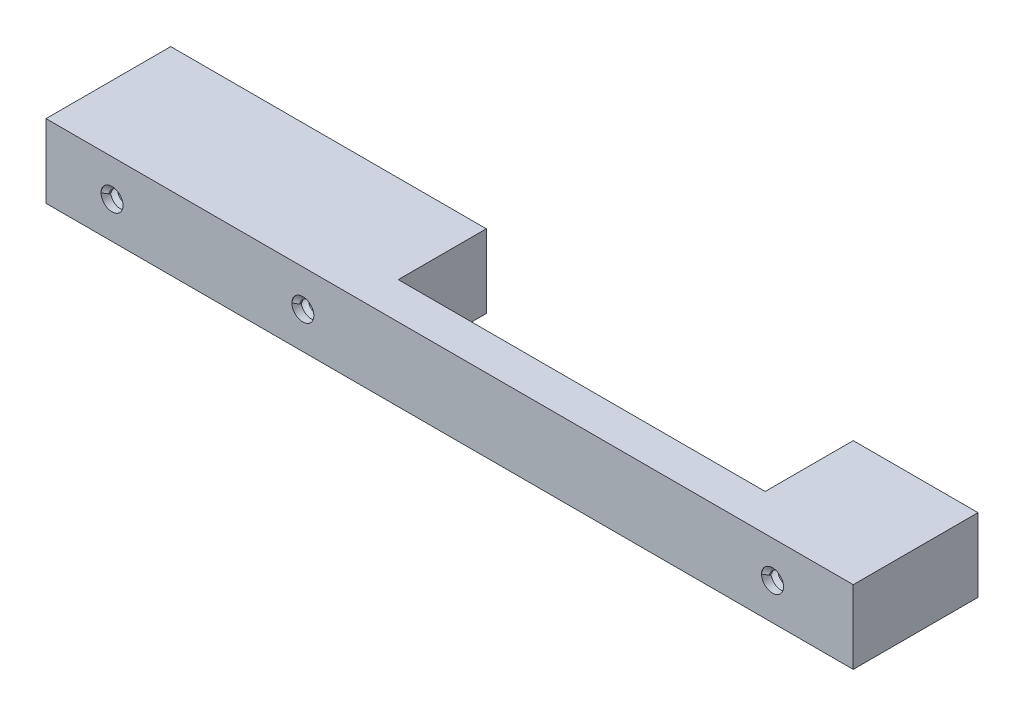
from build123d import *

# Parameters (mm, degrees)
CROQUIS1_W                = 110
CROQUIS1_H                = 10
CROQUIS1_R                = 1.5
SALIENTE_EXTRUIR1_DEPTH   = 17
ROSCA1_PITCH              = 1.25
ROSCA2_PITCH              = 1.25
ROSCA3_PITCH              = 1.25
CORTAR_EXTRUIR1_START     = -10
CORTAR_EXTRUIR1_OUTLINE_W = 50
CORTAR_EXTRUIR1_OUTLINE_H = 12
CORTAR_EXTRUIR1_DEPTH     = 10


with BuildPart() as part:
    # Croquis1 → Saliente-Extruir1 (new body)
    with BuildSketch(Plane.XY):
        with Locations((-11.62601626, 12.737127371)):
            Rectangle(CROQUIS1_W, CROQUIS1_H)
        with Locations((-31.62601626, 12.737127371)):
            Circle(CROQUIS1_R, mode=Mode.SUBTRACT)
        with Locations((-57.62601626, 12.737127371)):
            Circle(CROQUIS1_R, mode=Mode.SUBTRACT)
        with Locations((32.37398374, 12.737127371)):
            Circle(CROQUIS1_R, mode=Mode.SUBTRACT)
    extrude(amount=SALIENTE_EXTRUIR1_DEPTH)

    # Rosca1: arcs per turn and ends read off the stored shape
    # Rosca1: the profile of Perfil de rosca1 profile screwed along a right-hand helix through 12 turns, 8 arcs to a turn; built about Z, then put on its axis
    rosca1_z = Axis((0, 0, 0), (0, 0, 1))
    rosca1_corners = [(1.5003, 0, -0.000173205), (1.5003, 0, 1.093923202), (0.823417656, 0, 0.703124998), (0.823417656, 0, 0.390624998)]
    with BuildLine(mode=Mode.PRIVATE) as rosca1_profile:
        Line(rosca1_corners[0], rosca1_corners[1])
        Line(rosca1_corners[1], rosca1_corners[2])
        Line(rosca1_corners[2], rosca1_corners[3])
        Line(rosca1_corners[3], rosca1_corners[0])
    rosca1_cap = Face(rosca1_profile.wire())
    rosca1_turn_angles = [0, 22.5, 45, 67.5, 90, 112.5, 135, 157.5, 180, 202.5, 225, 247.5, 270, 292.5, 315, 337.5, 360]
    rosca1_turn_weights = [1, 0.9238795325112867, 1, 0.9238795325112867, 1, 0.9238795325112867, 1, 0.9238795325112867, 1, 0.9238795325112867, 1, 0.9238795325112867, 1, 0.9238795325112867, 1, 0.9238795325112867, 1]
    rosca1_turn_rails = [Edge.make_bspline([Vector(p[0], p[1], 0).rotate(rosca1_z, rosca1_turn_angles[k]) / rosca1_turn_weights[k] + Vector(0, 0, p[2] + ROSCA1_PITCH * rosca1_turn_angles[k] / 360) for k in range(17)], [0, 0, 0, 1, 1, 2, 2, 3, 3, 4, 4, 5, 5, 6, 6, 7, 7, 8, 8, 8], 2, rosca1_turn_weights) for p in rosca1_corners]
    rosca1_turn_sides = [Face.make_surface_from_curves(rosca1_turn_rails[p[0]], rosca1_turn_rails[p[1]]) for p in [(0, 1), (1, 2), (2, 3), (3, 0)]]
    rosca1 = Plane(origin=(-31.62601626, 12.737127371, 17), x_dir=(-1, 0, 0), z_dir=(0, 0, -1)) * Solid(Shell([*[p.moved(Location((0, 0, ROSCA1_PITCH * i))) for i in range(12) for p in rosca1_turn_sides], rosca1_cap, rosca1_cap.rotate(rosca1_z, 4320).moved(Location((0, 0, ROSCA1_PITCH * 4320 / 360)))]))
    add(rosca1)

    # Rosca2: arcs per turn and ends read off the stored shape
    # Rosca2: the profile of Perfil de rosca2 profile screwed along a right-hand helix through 12 turns, 8 arcs to a turn; built about Z, then put on its axis
    rosca2_z = Axis((0, 0, 0), (0, 0, 1))
    rosca2_corners = [(1.5003, 0, -0.000173205), (1.5003, 0, 1.093923202), (0.823417656, 0, 0.703124998), (0.823417656, 0, 0.390624998)]
    with BuildLine(mode=Mode.PRIVATE) as rosca2_profile:
        Line(rosca2_corners[0], rosca2_corners[1])
        Line(rosca2_corners[1], rosca2_corners[2])
        Line(rosca2_corners[2], rosca2_corners[3])
        Line(rosca2_corners[3], rosca2_corners[0])
    rosca2_cap = Face(rosca2_profile.wire())
    rosca2_turn_angles = [0, 22.5, 45, 67.5, 90, 112.5, 135, 157.5, 180, 202.5, 225, 247.5, 270, 292.5, 315, 337.5, 360]
    rosca2_turn_weights = [1, 0.9238795325112867, 1, 0.9238795325112867, 1, 0.9238795325112867, 1, 0.9238795325112867, 1, 0.9238795325112867, 1, 0.9238795325112867, 1, 0.9238795325112867, 1, 0.9238795325112867, 1]
    rosca2_turn_rails = [Edge.make_bspline([Vector(p[0], p[1], 0).rotate(rosca2_z, rosca2_turn_angles[k]) / rosca2_turn_weights[k] + Vector(0, 0, p[2] + ROSCA2_PITCH * rosca2_turn_angles[k] / 360) for k in range(17)], [0, 0, 0, 1, 1, 2, 2, 3, 3, 4, 4, 5, 5, 6, 6, 7, 7, 8, 8, 8], 2, rosca2_turn_weights) for p in rosca2_corners]
    rosca2_turn_sides = [Face.make_surface_from_curves(rosca2_turn_rails[p[0]], rosca2_turn_rails[p[1]]) for p in [(0, 1), (1, 2), (2, 3), (3, 0)]]
    rosca2 = Plane(origin=(-57.62601626, 12.737127371, 17), x_dir=(-1, 0, 0), z_dir=(0, 0, -1)) * Solid(Shell([*[p.moved(Location((0, 0, ROSCA2_PITCH * i))) for i in range(12) for p in rosca2_turn_sides], rosca2_cap, rosca2_cap.rotate(rosca2_z, 4320).moved(Location((0, 0, ROSCA2_PITCH * 4320 / 360)))]))
    add(rosca2)

    # Rosca3: arcs per turn and ends read off the stored shape
    # Rosca3: the profile of Perfil de rosca3 profile screwed along a right-hand helix through 12 turns, 8 arcs to a turn; built about Z, then put on its axis
    rosca3_z = Axis((0, 0, 0), (0, 0, 1))
    rosca3_corners = [(1.5003, 0, -0.000173205), (1.5003, 0, 1.093923202), (0.823417656, 0, 0.703124998), (0.823417656, 0, 0.390624998)]
    with BuildLine(mode=Mode.PRIVATE) as rosca3_profile:
        Line(rosca3_corners[0], rosca3_corners[1])
        Line(rosca3_corners[1], rosca3_corners[2])
        Line(rosca3_corners[2], rosca3_corners[3])
        Line(rosca3_corners[3], rosca3_corners[0])
    rosca3_cap = Face(rosca3_profile.wire())
    rosca3_turn_angles = [0, 22.5, 45, 67.5, 90, 112.5, 135, 157.5, 180, 202.5, 225, 247.5, 270, 292.5, 315, 337.5, 360]
    rosca3_turn_weights = [1, 0.9238795325112867, 1, 0.9238795325112867, 1, 0.9238795325112867, 1, 0.9238795325112867, 1, 0.9238795325112867, 1, 0.9238795325112867, 1, 0.9238795325112867, 1, 0.9238795325112867, 1]
    rosca3_turn_rails = [Edge.make_bspline([Vector(p[0], p[1], 0).rotate(rosca3_z, rosca3_turn_angles[k]) / rosca3_turn_weights[k] + Vector(0, 0, p[2] + ROSCA3_PITCH * rosca3_turn_angles[k] / 360) for k in range(17)], [0, 0, 0, 1, 1, 2, 2, 3, 3, 4, 4, 5, 5, 6, 6, 7, 7, 8, 8, 8], 2, rosca3_turn_weights) for p in rosca3_corners]
    rosca3_turn_sides = [Face.make_surface_from_curves(rosca3_turn_rails[p[0]], rosca3_turn_rails[p[1]]) for p in [(0, 1), (1, 2), (2, 3), (3, 0)]]
    rosca3 = Plane(origin=(32.37398374, 12.737127371, 17), x_dir=(-1, 0, 0), z_dir=(0, 0, -1)) * Solid(Shell([*[p.moved(Location((0, 0, ROSCA3_PITCH * i))) for i in range(12) for p in rosca3_turn_sides], rosca3_cap, rosca3_cap.rotate(rosca3_z, 4320).moved(Location((0, 0, ROSCA3_PITCH * 4320 / 360)))]))
    add(rosca3)

    # Cortar-Extruir1: read off the stored shape, not the designer's step
    # Cortar-Extruir1 outline → Cortar-Extruir1 (cut)
    with BuildSketch(Plane.XZ.offset(-7.737127371).offset(CORTAR_EXTRUIR1_START)):
        with Locations((1.37398374, 6)):
            Rectangle(CORTAR_EXTRUIR1_OUTLINE_W, CORTAR_EXTRUIR1_OUTLINE_H)
    extrude(amount=CORTAR_EXTRUIR1_DEPTH, mode=Mode.SUBTRACT)


solid = part.part
